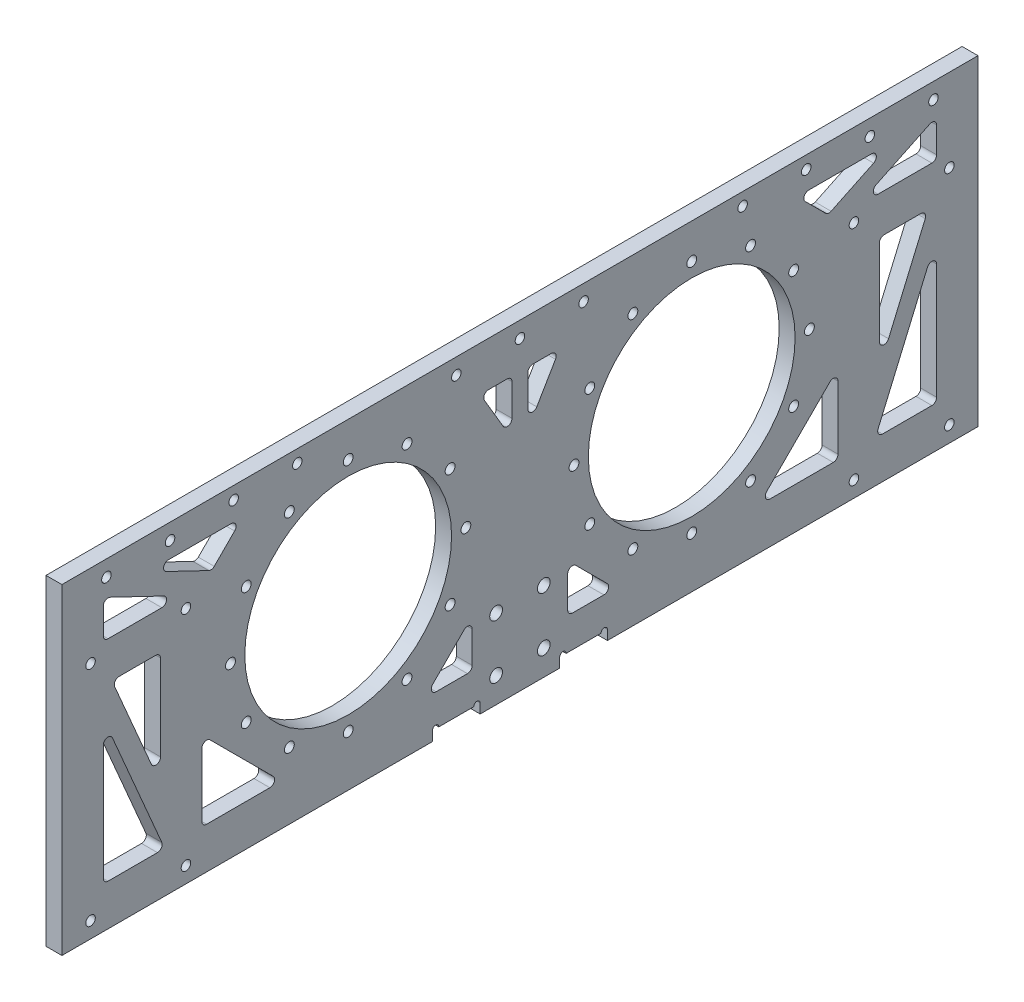
from build123d import *

# Parameters (mm, degrees)
SKETCH_1_W          = 288
SKETCH_1_H          = 101
SKETCH_1_R          = 32.5
SKETCH_1_R_2        = 1.55
SKETCH_1_R_3        = 2
SKETCH_1_R_4        = 1.5
EXTRUDE_1_DEPTH     = 5
SKETCH_2_R          = 1.5
CUT_EXTRUDE_1_DEPTH = 206.031704865
SKETCH_3_R          = 1.5
CUT_EXTRUDE_2_DEPTH = 10
CUT_EXTRUDE_3_DEPTH = 206.031704865
CUT_EXTRUDE_4_DEPTH = 206.031704865


with BuildPart() as part:
    # 草图1 → 凸台-拉伸1 (new body)
    with BuildSketch(Plane(origin=(0, 0, 0), x_dir=(0, 0, -1), z_dir=(1, 0, 0))):
        with Locations((54, -2.5)):
            Rectangle(SKETCH_1_W, SKETCH_1_H)
        Circle(SKETCH_1_R, mode=Mode.SUBTRACT)
        with Locations((0, 37)):
            Circle(SKETCH_1_R_2, mode=Mode.SUBTRACT)
        with Locations((18.5, 32.04293994)):
            Circle(SKETCH_1_R_2, mode=Mode.SUBTRACT)
        with Locations((32.04293994, 18.5)):
            Circle(SKETCH_1_R_2, mode=Mode.SUBTRACT)
        with Locations((37, 0)):
            Circle(SKETCH_1_R_2, mode=Mode.SUBTRACT)
        with Locations((32.04293994, -18.5)):
            Circle(SKETCH_1_R_2, mode=Mode.SUBTRACT)
        with Locations((18.5, -32.04293994)):
            Circle(SKETCH_1_R_2, mode=Mode.SUBTRACT)
        with Locations((0, -37)):
            Circle(SKETCH_1_R_2, mode=Mode.SUBTRACT)
        with Locations((-18.5, -32.04293994)):
            Circle(SKETCH_1_R_2, mode=Mode.SUBTRACT)
        with Locations((-32.04293994, -18.5)):
            Circle(SKETCH_1_R_2, mode=Mode.SUBTRACT)
        with Locations((-37, 0)):
            Circle(SKETCH_1_R_2, mode=Mode.SUBTRACT)
        with Locations((-32.04293994, 18.5)):
            Circle(SKETCH_1_R_2, mode=Mode.SUBTRACT)
        with Locations((-18.5, 32.04293994)):
            Circle(SKETCH_1_R_2, mode=Mode.SUBTRACT)
        with Locations((126.5, 32.04293994)):
            Circle(SKETCH_1_R_2, mode=Mode.SUBTRACT)
        with Locations((140.04293994, 18.5)):
            Circle(SKETCH_1_R_2, mode=Mode.SUBTRACT)
        with Locations((145, 0)):
            Circle(SKETCH_1_R_2, mode=Mode.SUBTRACT)
        with Locations((140.04293994, -18.5)):
            Circle(SKETCH_1_R_2, mode=Mode.SUBTRACT)
        with Locations((126.5, -32.04293994)):
            Circle(SKETCH_1_R_2, mode=Mode.SUBTRACT)
        with Locations((108, -37)):
            Circle(SKETCH_1_R_2, mode=Mode.SUBTRACT)
        with Locations((89.5, -32.04293994)):
            Circle(SKETCH_1_R_2, mode=Mode.SUBTRACT)
        with Locations((75.95706006, -18.5)):
            Circle(SKETCH_1_R_2, mode=Mode.SUBTRACT)
        with Locations((71, 0)):
            Circle(SKETCH_1_R_2, mode=Mode.SUBTRACT)
        with Locations((75.95706006, 18.5)):
            Circle(SKETCH_1_R_2, mode=Mode.SUBTRACT)
        with Locations((89.5, 32.04293994)):
            Circle(SKETCH_1_R_2, mode=Mode.SUBTRACT)
        with Locations((108, 37)):
            Circle(SKETCH_1_R_2, mode=Mode.SUBTRACT)
        with Locations((108, 0)):
            Circle(SKETCH_1_R, mode=Mode.SUBTRACT)
        with Locations((61.5, -28)):
            Circle(SKETCH_1_R_3, mode=Mode.SUBTRACT)
        with Locations((46.5, -28)):
            Circle(SKETCH_1_R_3, mode=Mode.SUBTRACT)
        with Locations((46.5, -45)):
            Circle(SKETCH_1_R_3, mode=Mode.SUBTRACT)
        with Locations((61.5, -45)):
            Circle(SKETCH_1_R_3, mode=Mode.SUBTRACT)
        with Locations((-16, 44)):
            Circle(SKETCH_1_R_4, mode=Mode.SUBTRACT)
        with Locations((-36, 44)):
            Circle(SKETCH_1_R_4, mode=Mode.SUBTRACT)
        with Locations((124, 44)):
            Circle(SKETCH_1_R_4, mode=Mode.SUBTRACT)
        with Locations((144, 44)):
            Circle(SKETCH_1_R_4, mode=Mode.SUBTRACT)
    extrude(amount=EXTRUDE_1_DEPTH)

    # 草图2 → 切除-拉伸1 (cut, through all)
    with BuildSketch(Plane(origin=(5, 0, 0), x_dir=(0, 0, -1), z_dir=(1, 0, 0))):
        with Locations((-76, 43)):
            Circle(SKETCH_2_R)
        with Locations((-56, 43)):
            Circle(SKETCH_2_R)
        with Locations((164, 43)):
            Circle(SKETCH_2_R)
        with Locations((184, 43)):
            Circle(SKETCH_2_R)
        with Locations((34, 43)):
            Circle(SKETCH_2_R)
        with Locations((54, 43)):
            Circle(SKETCH_2_R)
        with Locations((74, 43)):
            Circle(SKETCH_2_R)
    extrude(amount=-CUT_EXTRUDE_1_DEPTH, mode=Mode.SUBTRACT)

    # 草图3 → 切除-拉伸2 (cut)
    with BuildSketch(Plane(origin=(5, 0, 0), x_dir=(0, 0, -1), z_dir=(1, 0, 0))):
        with Locations((-81, -48)):
            Circle(SKETCH_3_R)
        with Locations((-51, -48)):
            Circle(SKETCH_3_R)
        with Locations((-81, 22)):
            Circle(SKETCH_3_R)
        with Locations((-51, 22)):
            Circle(SKETCH_3_R)
        with Locations((159, 22)):
            Circle(SKETCH_3_R)
        with Locations((189, 22)):
            Circle(SKETCH_3_R)
        with Locations((159, -48)):
            Circle(SKETCH_3_R)
        with Locations((189, -48)):
            Circle(SKETCH_3_R)
    extrude(amount=-CUT_EXTRUDE_2_DEPTH, mode=Mode.SUBTRACT)

    # 草图4 → 切除-拉伸3 (cut, through all)
    with BuildSketch(Plane(origin=(5, 0, 0), x_dir=(0, 0, -1), z_dir=(1, 0, 0))):
        with BuildLine():
            Line((44.122624964, 34), (50, 34))
            ThreePointArc((50, 34), (51.060660172, 33.560660172), (51.5, 32.5))
            Line((51.5, 32.5), (51.5, 22.508462438))
            ThreePointArc((51.5, 22.508462438), (50.394111669, 21.061162887), (48.707098677, 21.747932249))
            Line((48.707098677, 21.747932249), (42.829723641, 31.73946981))
            ThreePointArc((42.829723641, 31.73946981), (42.820550603, 33.244716293), (44.122624964, 34))
        make_face()
        with BuildLine():
            Line((56.5, 32.5), (56.5, 22.508462438))
            ThreePointArc((56.5, 22.508462438), (57.605888331, 21.061162887), (59.292901323, 21.747932249))
            Line((59.292901323, 21.747932249), (65.170276359, 31.73946981))
            ThreePointArc((65.170276359, 31.73946981), (65.179449397, 33.244716293), (63.877375036, 34))
            Line((63.877375036, 34), (58, 34))
            ThreePointArc((58, 34), (56.939339828, 33.560660172), (56.5, 32.5))
        make_face()
        with BuildLine():
            Line((-77, -2.256992992), (-77, -38.5))
            ThreePointArc((-77, -38.5), (-76.560660172, -39.560660172), (-75.5, -40))
            Line((-75.5, -40), (-59.967282711, -40))
            ThreePointArc((-59.967282711, -40), (-58.715021073, -39.325736513), (-58.588565166, -37.909121052))
            Line((-58.588565166, -37.909121052), (-74.121282455, -1.666114044))
            ThreePointArc((-74.121282455, -1.666114044), (-75.801598808, -0.787626408), (-77, -2.256992992))
        make_face()
        with BuildLine():
            Line((-72.032717289, 14), (-60.5, 14))
            ThreePointArc((-60.5, 14), (-59.439339828, 13.560660172), (-59, 12.5))
            Line((-59, 12.5), (-59, -14.409673675))
            ThreePointArc((-59, -14.409673675), (-60.198401192, -15.879040259), (-61.878717545, -15.000552622))
            Line((-61.878717545, -15.000552622), (-73.411434834, 11.909121052))
            ThreePointArc((-73.411434834, 11.909121052), (-73.284978927, 13.325736513), (-72.032717289, 14))
        make_face()
        with BuildLine():
            Line((-46, -18.621320344), (-46, -38.5))
            ThreePointArc((-46, -38.5), (-45.560660172, -39.560660172), (-44.5, -40))
            Line((-44.5, -40), (-24.621320344, -40))
            ThreePointArc((-24.621320344, -40), (-23.235501045, -39.074025149), (-23.560660172, -37.439339828))
            Line((-23.560660172, -37.439339828), (-43.439339828, -17.560660172))
            ThreePointArc((-43.439339828, -17.560660172), (-45.074025149, -17.235501045), (-46, -18.621320344))
        make_face()
        with BuildLine():
            Line((-77, 35.616149045), (-77, 27.5))
            ThreePointArc((-77, 27.5), (-76.560660172, 26.439339828), (-75.5, 26))
            Line((-75.5, 26), (-58.591356156, 26))
            ThreePointArc((-58.591356156, 26), (-57.128751138, 27.167153849), (-57.942259555, 28.852284586))
            Line((-57.942259555, 28.852284586), (-74.850903399, 36.968433631))
            ThreePointArc((-74.850903399, 36.968433631), (-76.298860156, 36.885724742), (-77, 35.616149045))
        make_face()
        with BuildLine():
            Line((-56.54321922, 38), (-36.75589572, 38))
            ThreePointArc((-36.75589572, 38), (-35.370076421, 37.074025149), (-35.695235548, 35.439339828))
            Line((-35.695235548, 35.439339828), (-42.112745872, 29.021829504))
            ThreePointArc((-42.112745872, 29.021829504), (-42.921201082, 28.603844127), (-43.822502646, 28.730205089))
            Line((-43.822502646, 28.730205089), (-57.192315822, 35.147715414))
            ThreePointArc((-57.192315822, 35.147715414), (-58.005824239, 36.832846151), (-56.54321922, 38))
        make_face()
        with BuildLine():
            Line((27.621320344, -40), (37.5, -40))
            ThreePointArc((37.5, -40), (38.560660172, -39.560660172), (39, -38.5))
            Line((39, -38.5), (39, -28.621320344))
            ThreePointArc((39, -28.621320344), (38.074025149, -27.235501045), (36.439339828, -27.560660172))
            Line((36.439339828, -27.560660172), (26.560660172, -37.439339828))
            ThreePointArc((26.560660172, -37.439339828), (26.235501045, -39.074025149), (27.621320344, -40))
        make_face()
        with BuildLine():
            Line((71.560660172, -27.560660172), (81.439339828, -37.439339828))
            ThreePointArc((81.439339828, -37.439339828), (81.764498955, -39.074025149), (80.378679656, -40))
            Line((80.378679656, -40), (70.5, -40))
            ThreePointArc((70.5, -40), (69.439339828, -39.560660172), (69, -38.5))
            Line((69, -38.5), (69, -28.621320344))
            ThreePointArc((69, -28.621320344), (69.925974851, -27.235501045), (71.560660172, -27.560660172))
        make_face()
        with BuildLine():
            Line((151.822502646, 28.730205089), (165.192315822, 35.147715414))
            ThreePointArc((165.192315822, 35.147715414), (166.005824239, 36.832846151), (164.54321922, 38))
            Line((164.54321922, 38), (144.75589572, 38))
            ThreePointArc((144.75589572, 38), (143.370076421, 37.074025149), (143.695235548, 35.439339828))
            Line((143.695235548, 35.439339828), (150.112745872, 29.021829504))
            ThreePointArc((150.112745872, 29.021829504), (150.921201082, 28.603844127), (151.822502646, 28.730205089))
        make_face()
        with BuildLine():
            Line((165.942259555, 28.852284586), (182.850903399, 36.968433631))
            ThreePointArc((182.850903399, 36.968433631), (184.298860156, 36.885724742), (185, 35.616149045))
            Line((185, 35.616149045), (185, 27.5))
            ThreePointArc((185, 27.5), (184.560660172, 26.439339828), (183.5, 26))
            Line((183.5, 26), (166.591356156, 26))
            ThreePointArc((166.591356156, 26), (165.128751138, 27.167153849), (165.942259555, 28.852284586))
        make_face()
        with BuildLine():
            Line((131.560660172, -37.439339828), (151.439339828, -17.560660172))
            ThreePointArc((151.439339828, -17.560660172), (153.074025149, -17.235501045), (154, -18.621320344))
            Line((154, -18.621320344), (154, -38.5))
            ThreePointArc((154, -38.5), (153.560660172, -39.560660172), (152.5, -40))
            Line((152.5, -40), (132.621320344, -40))
            ThreePointArc((132.621320344, -40), (131.235501045, -39.074025149), (131.560660172, -37.439339828))
        make_face()
        with BuildLine():
            Line((169.878717545, -15.000552622), (181.411434834, 11.909121052))
            ThreePointArc((181.411434834, 11.909121052), (181.284978927, 13.325736513), (180.032717289, 14))
            Line((180.032717289, 14), (168.5, 14))
            ThreePointArc((168.5, 14), (167.439339828, 13.560660172), (167, 12.5))
            Line((167, 12.5), (167, -14.409673675))
            ThreePointArc((167, -14.409673675), (168.198401192, -15.879040259), (169.878717545, -15.000552622))
        make_face()
        with BuildLine():
            Line((166.588565166, -37.909121052), (182.121282455, -1.666114044))
            ThreePointArc((182.121282455, -1.666114044), (183.801598808, -0.787626408), (185, -2.256992992))
            Line((185, -2.256992992), (185, -38.5))
            ThreePointArc((185, -38.5), (184.560660172, -39.560660172), (183.5, -40))
            Line((183.5, -40), (167.967282711, -40))
            ThreePointArc((167.967282711, -40), (166.715021073, -39.325736513), (166.588565166, -37.909121052))
        make_face()
    extrude(amount=-CUT_EXTRUDE_3_DEPTH, mode=Mode.SUBTRACT)

    # 草图6 → 切除-拉伸4 (cut, through all)
    with BuildSketch(Plane(origin=(5, 0, 0), x_dir=(0, 0, -1), z_dir=(1, 0, 0))):
        with BuildLine():
            Line((41.5, -53), (41.5, -50))
            ThreePointArc((41.5, -50), (40.5, -49), (39.5, -50))
            Line((39.5, -50), (28.5, -50))
            ThreePointArc((28.5, -50), (27.5, -49), (26.5, -50))
            Line((26.5, -50), (26.5, -53))
            Line((26.5, -53), (41.5, -53))
        make_face()
        with BuildLine():
            Line((81.5, -53), (66.5, -53))
            Line((66.5, -53), (66.5, -50))
            ThreePointArc((66.5, -50), (67.5, -49), (68.5, -50))
            Line((68.5, -50), (79.5, -50))
            ThreePointArc((79.5, -50), (80.5, -49), (81.5, -50))
            Line((81.5, -50), (81.5, -53))
        make_face()
    extrude(amount=-CUT_EXTRUDE_4_DEPTH, mode=Mode.SUBTRACT)


solid = part.part
